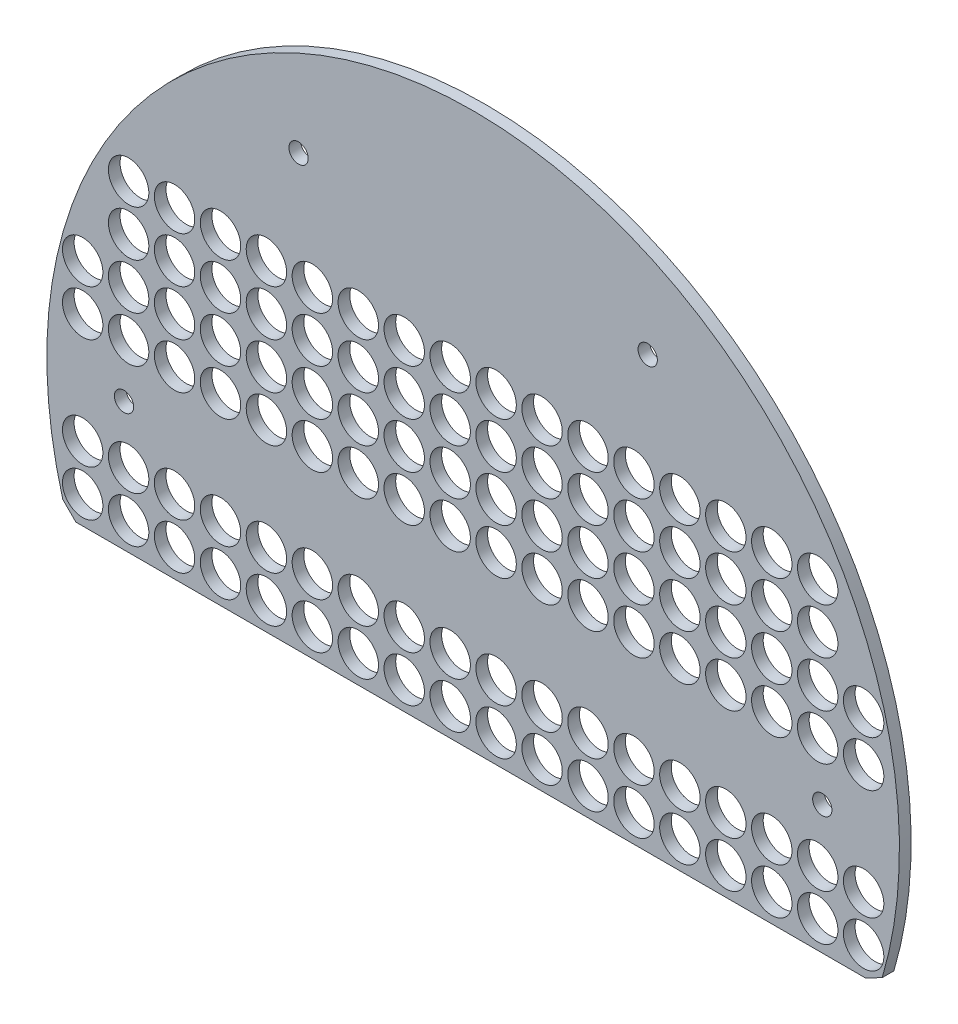
from build123d import *

# Parameters (mm, degrees)
BOSS_EXTRUDE1_DEPTH   = 6.35
CHAMFER1_SIZE         = 5
CHAMFER1_SIZE_2       = 7.672581673
SKETCH2_R             = 5.25
CUT_EXTRUDE1_DEPTH    = 329.158989668
SKETCH3_R             = 11
CUT_EXTRUDE2_DEPTH    = 329.158989668
BODY_MOVE_COPY1_ANGLE = 180


with BuildPart() as part:
    # Sketch1 → Boss-Extrude1 (new body)
    with BuildSketch(Plane.XY):
        with BuildLine():
            Line((-221.187703094, 70), (221.187703094, 70))
            ThreePointArc((221.187703094, 70), (0, -232), (-221.187703094, 70))
        make_face()
    extrude(amount=BOSS_EXTRUDE1_DEPTH)

    # Chamfer1
    # the kernel refuses this chamfer: 7.672581673, 5 mm, written as the material it takes off along each edge
    with BuildSketch(Plane(origin=(-221.187703094, 70, -19.287514673), x_dir=(1, 0, 0), z_dir=(0, 0, 1))) as chamfer1_piece_1:
        with BuildLine():
            Line((CHAMFER1_SIZE, 0), (-2.131765618, -7.131765618))
            ThreePointArc((-2.131765618, -7.131765618), (-1.133115382, -3.68670064), (0, 0))
            Line((0, 0), (CHAMFER1_SIZE, 0))
        make_face()
    extrude(amount=44.925029345, mode=Mode.SUBTRACT)
    with BuildSketch(Plane(origin=(221.187703094, 70, -19.865544851), x_dir=(-1, 0, 0), z_dir=(0, 0, 1))) as chamfer1_piece_2:
        with BuildLine():
            Line((CHAMFER1_SIZE_2, 0), (-1.44240767, 4.732597867))
            ThreePointArc((-1.44240767, 4.732597867), (-0.765078162, 2.465098705), (0, 0))
            Line((0, 0), (CHAMFER1_SIZE_2, 0))
        make_face()
    extrude(amount=46.081089702, mode=Mode.SUBTRACT)

    # Sketch2 → Cut-Extrude1 (cut, through all)
    with BuildSketch(Plane.XY.offset(6.35)):
        with Locations((-190, 0)):
            Circle(SKETCH2_R)
        with Locations((190, 0)):
            Circle(SKETCH2_R)
        with Locations((95, -164.544826719)):
            Circle(SKETCH2_R)
        with Locations((-95, -164.544826719)):
            Circle(SKETCH2_R)
    extrude(amount=-CUT_EXTRUDE1_DEPTH, mode=Mode.SUBTRACT)

    # Sketch3 → Cut-Extrude2 (cut, through all)
    with BuildSketch(Plane.XY.offset(6.35)):
        with Locations((12.5, -30)):
            Circle(SKETCH3_R)
        with Locations((12.5, -55)):
            Circle(SKETCH3_R)
        with Locations((12.5, -80)):
            Circle(SKETCH3_R)
        with Locations((12.5, -105)):
            Circle(SKETCH3_R)
        with Locations((37.5, -30)):
            Circle(SKETCH3_R)
        with Locations((37.5, -55)):
            Circle(SKETCH3_R)
        with Locations((62.5, -30)):
            Circle(SKETCH3_R)
        with Locations((62.5, -55)):
            Circle(SKETCH3_R)
        with Locations((87.5, -30)):
            Circle(SKETCH3_R)
        with Locations((87.5, -55)):
            Circle(SKETCH3_R)
        with Locations((112.5, -30)):
            Circle(SKETCH3_R)
        with Locations((112.5, -55)):
            Circle(SKETCH3_R)
        with Locations((137.5, -30)):
            Circle(SKETCH3_R)
        with Locations((137.5, -55)):
            Circle(SKETCH3_R)
        with Locations((162.5, -30)):
            Circle(SKETCH3_R)
        with Locations((162.5, -55)):
            Circle(SKETCH3_R)
        with Locations((187.5, -30)):
            Circle(SKETCH3_R)
        with Locations((187.5, -55)):
            Circle(SKETCH3_R)
        with Locations((212.5, -30)):
            Circle(SKETCH3_R)
        with Locations((212.5, -55)):
            Circle(SKETCH3_R)
        with Locations((37.5, -80)):
            Circle(SKETCH3_R)
        with Locations((37.5, -105)):
            Circle(SKETCH3_R)
        with Locations((62.5, -80)):
            Circle(SKETCH3_R)
        with Locations((62.5, -105)):
            Circle(SKETCH3_R)
        with Locations((87.5, -80)):
            Circle(SKETCH3_R)
        with Locations((87.5, -105)):
            Circle(SKETCH3_R)
        with Locations((112.5, -80)):
            Circle(SKETCH3_R)
        with Locations((112.5, -105)):
            Circle(SKETCH3_R)
        with Locations((137.5, -80)):
            Circle(SKETCH3_R)
        with Locations((137.5, -105)):
            Circle(SKETCH3_R)
        with Locations((162.5, -80)):
            Circle(SKETCH3_R)
        with Locations((162.5, -105)):
            Circle(SKETCH3_R)
        with Locations((187.5, -80)):
            Circle(SKETCH3_R)
        with Locations((187.5, -105)):
            Circle(SKETCH3_R)
        with Locations((12.5, 30)):
            Circle(SKETCH3_R)
        with Locations((12.5, 55)):
            Circle(SKETCH3_R)
        with Locations((37.5, 55)):
            Circle(SKETCH3_R)
        with Locations((37.5, 30)):
            Circle(SKETCH3_R)
        with Locations((62.5, 55)):
            Circle(SKETCH3_R)
        with Locations((62.5, 30)):
            Circle(SKETCH3_R)
        with Locations((87.5, 55)):
            Circle(SKETCH3_R)
        with Locations((87.5, 30)):
            Circle(SKETCH3_R)
        with Locations((112.5, 55)):
            Circle(SKETCH3_R)
        with Locations((112.5, 30)):
            Circle(SKETCH3_R)
        with Locations((137.5, 55)):
            Circle(SKETCH3_R)
        with Locations((137.5, 30)):
            Circle(SKETCH3_R)
        with Locations((162.5, 55)):
            Circle(SKETCH3_R)
        with Locations((162.5, 30)):
            Circle(SKETCH3_R)
        with Locations((187.5, 55)):
            Circle(SKETCH3_R)
        with Locations((187.5, 30)):
            Circle(SKETCH3_R)
        with Locations((212.5, 55)):
            Circle(SKETCH3_R)
        with Locations((212.5, 30)):
            Circle(SKETCH3_R)
    cut_extrude2 = extrude(amount=-CUT_EXTRUDE2_DEPTH, mode=Mode.SUBTRACT)

    # Mirror2: Cut-Extrude2 across plane
    add(cut_extrude2.mirror(Plane(origin=(0, 0, 0), x_dir=(0, 0, 1), z_dir=(1, 0, 0))), mode=Mode.SUBTRACT)


with BuildPart() as part_1:
    # Body-Move/Copy1: moved
    add(part.part.rotate(Axis((0, 0, 0), (1, 0, 0)), BODY_MOVE_COPY1_ANGLE))


solid = part_1.part
